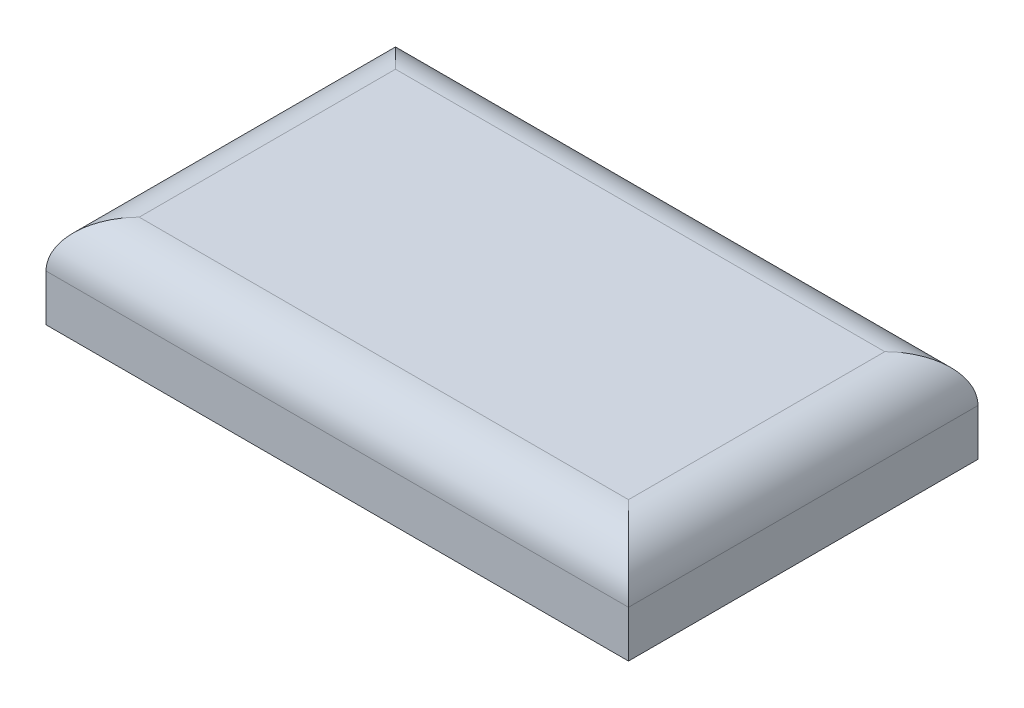
from build123d import *

# Parameters (mm, degrees)
SKETCH1_W           = 250
SKETCH1_H           = 150
BOSS_EXTRUDE1_DEPTH = 40
FILLET1_START       = -75
FILLET1_DEPTH       = 150
FILLET1_START_2     = -126
FILLET1_2_DEPTH     = 252


with BuildPart() as part:
    # Sketch1 → Boss-Extrude1 (new body)
    with BuildSketch(Plane(origin=(0, 0, 0), x_dir=(1, 0, 0), z_dir=(0, 1, 0))):
        Rectangle(SKETCH1_W, SKETCH1_H)
    extrude(amount=BOSS_EXTRUDE1_DEPTH)

    # Fillet1: read off the stored shape, not the designer's step
    # Fillet1 outline → Fillet1 (cut)
    with BuildSketch(Plane.XY.offset(FILLET1_START)):
        with BuildLine():
            Line((-125, 40), (-125, 20))
            ThreePointArc((-125, 20), (-119.142135624, 34.142135624), (-105, 40))
            Line((-105, 40), (-125, 40))
        make_face()
        with BuildLine():
            Line((125, 40), (105, 40))
            ThreePointArc((105, 40), (119.142135624, 34.142135624), (125, 20))
            Line((125, 20), (125, 40))
        make_face()
    extrude(amount=FILLET1_DEPTH, mode=Mode.SUBTRACT)

    # Fillet1 2 outline → Fillet1 2 (cut)
    with BuildSketch(Plane.YZ.offset(FILLET1_START_2)):
        with BuildLine():
            Line((40, 75), (20, 75))
            ThreePointArc((20, 75), (34.142135624, 69.142135624), (40, 55))
            Line((40, 55), (40, 75))
        make_face()
        with BuildLine():
            Line((40, -75), (40, -55))
            ThreePointArc((40, -55), (34.142135624, -69.142135624), (20, -75))
            Line((20, -75), (40, -75))
        make_face()
    extrude(amount=FILLET1_2_DEPTH, mode=Mode.SUBTRACT)


solid = part.part
